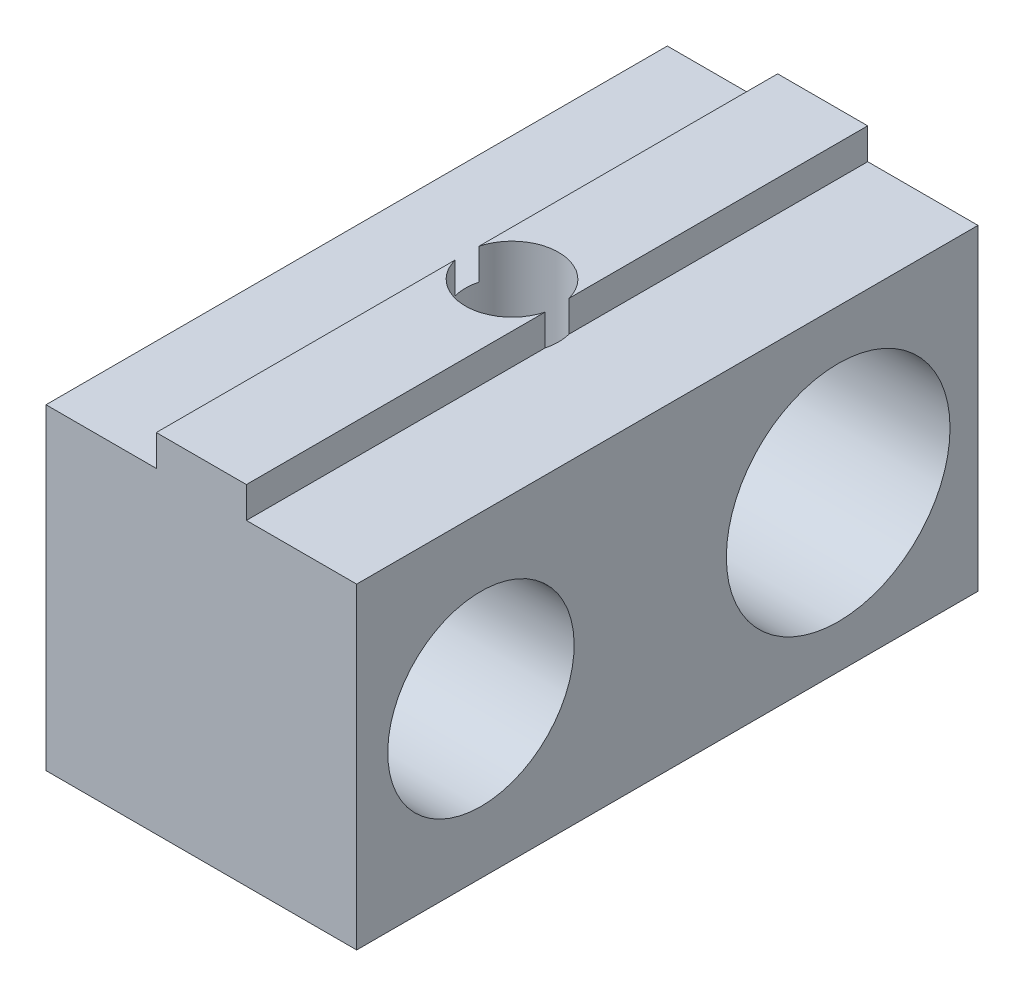
from build123d import *

# Parameters (mm, degrees)
MAKERBEAMFIX_DEPTH              = 10
SKETCH3_W                       = 20
SKETCH3_H                       = 10
SKETCH3_R                       = 3
SKETCH3_R_2                     = 3.6
DRILLKEYANDSMALLHEXDRIVER_DEPTH = 10
SKETCH4_R                       = 1.5
FIXINGHOLE_DEPTH                = 16.825296206
SKETCH5_R                       = 4.25
DRIVERHOLE_DEPTH                = 15.352700094


with BuildPart() as part:
    # Sketch1 → MakerBeamFix (new, symmetric)
    with BuildSketch(Plane.XY):
        Polygon((-5, 0), (5, 0), (5, 0.2), (1.45, 0.2), (1.45, 1.2), (-1.45, 1.2), (-1.45, 0.2), (-5, 0.2), align=None)
    extrude(amount=MAKERBEAMFIX_DEPTH, both=True)

    # Sketch3 → DrillKeyAndSmallHexDriver (add)
    with BuildSketch(Plane.ZY.offset(5)):
        with Locations((0, -5)):
            Rectangle(SKETCH3_W, SKETCH3_H)
        with Locations((6, -5)):
            Circle(SKETCH3_R, mode=Mode.SUBTRACT)
        with Locations((-5.5, -5)):
            Circle(SKETCH3_R_2, mode=Mode.SUBTRACT)
    extrude(amount=-DRILLKEYANDSMALLHEXDRIVER_DEPTH)

    # Sketch4 → FixingHole (cut, through all)
    with BuildSketch(Plane.XZ.offset(10)):
        Circle(SKETCH4_R)
    extrude(amount=-FIXINGHOLE_DEPTH, mode=Mode.SUBTRACT)

    # Sketch5 → DriverHole (cut, through all)
    with BuildSketch(Plane(origin=(0, -7.8, 0), x_dir=(1, 0, 0), z_dir=(0, 1, 0))):
        Circle(SKETCH5_R)
    extrude(amount=-DRIVERHOLE_DEPTH, mode=Mode.SUBTRACT)


solid = part.part
